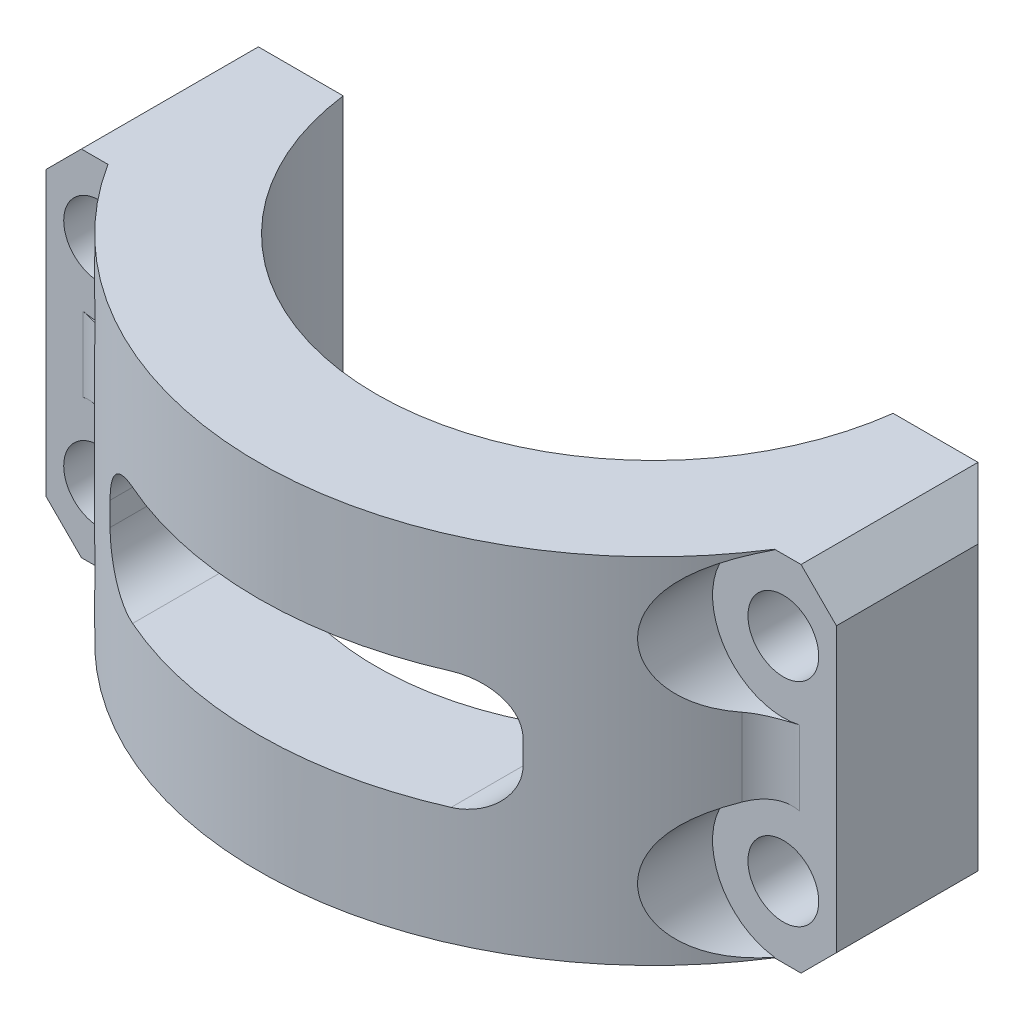
from build123d import *

# Parameters (mm, degrees)
BOSS_EXTRUDE1_DEPTH = 15
SKETCH2_R           = 3
CUT_EXTRUDE1_DEPTH  = 30
SKETCH3_W           = 35
SKETCH3_H           = 10
CUT_EXTRUDE2_DEPTH  = 50.694064129
FILLET1_R           = 4
SKETCH4_R           = 6
CUT_EXTRUDE3_DEPTH  = 30
FILLET2_R           = 4
CHAMFER1_SIZE       = 3


with BuildPart() as part:
    # Sketch1 → Boss-Extrude1 (new, symmetric)
    with BuildSketch(Plane(origin=(0, 0, 0), x_dir=(1, 0, 0), z_dir=(0, 1, 0))):
        with BuildLine():
            ThreePointArc((-28.253318389, -18), (-31.709094157, -10.806634433), (-33.365401241, -3))
            Line((-33.365401241, -3), (-33.5, -3))
            Line((-33.5, -3), (-33.5, -18))
            Line((-33.5, -18), (-28.253318389, -18))
        make_face()
        with BuildLine():
            Line((33.365401241, -3), (23.307724042, -3))
            ThreePointArc((23.307724042, -3), (0, -23.5), (-23.307724042, -3))
            Line((-23.307724042, -3), (-33.365401241, -3))
            ThreePointArc((-33.365401241, -3), (-31.709094157, -10.806634433), (-28.253318389, -18))
            ThreePointArc((-28.253318389, -18), (0, -33.5), (28.253318389, -18))
            ThreePointArc((28.253318389, -18), (31.709094157, -10.806634433), (33.365401241, -3))
        make_face()
        with BuildLine():
            Line((33.5, -3), (33.365401241, -3))
            ThreePointArc((33.365401241, -3), (31.709094157, -10.806634433), (28.253318389, -18))
            Line((28.253318389, -18), (33.5, -18))
            Line((33.5, -18), (33.5, -3))
        make_face()
    extrude(amount=BOSS_EXTRUDE1_DEPTH, both=True)

    # Sketch2 → Cut-Extrude1 (cut)
    with BuildSketch(Plane.XY):
        with Locations(Location((29, -9, 0), (0, 0, 180))):
            Circle(SKETCH2_R)
        with Locations(Location((29, 9, 0), (0, 0, 180))):
            Circle(SKETCH2_R)
        with Locations(Location((-29, 9, 0), (0, 0, 284.412066788))):
            Circle(SKETCH2_R)
        with Locations(Location((-29, -9, 0), (0, 0, 75.587933212))):
            Circle(SKETCH2_R)
    extrude(amount=CUT_EXTRUDE1_DEPTH, mode=Mode.SUBTRACT)

    # Sketch3 → Cut-Extrude2 (cut, through all)
    with BuildSketch(Plane.XY):
        Rectangle(SKETCH3_W, SKETCH3_H)
    extrude(amount=CUT_EXTRUDE2_DEPTH, mode=Mode.SUBTRACT)

    # Fillet1
    fillet1_edges = [part.edges().sort_by_distance(p)[0] for p in [
        (17.5, -5, 22.125050428),
        (17.5, 5, 22.125050428),
        (-17.5, 5, 22.125050428),
        (-17.5, -5, 22.125050428),
    ]]
    fillet(fillet1_edges, radius=FILLET1_R)

    # Sketch4 → Cut-Extrude3 (cut)
    with BuildSketch(Plane.XY.offset(18)):
        with Locations((29, 9)):
            Circle(SKETCH4_R)
        with Locations((29, -9)):
            Circle(SKETCH4_R)
        with Locations((-29, -9)):
            Circle(SKETCH4_R)
        with Locations((-29, 9)):
            Circle(SKETCH4_R)
    extrude(amount=CUT_EXTRUDE3_DEPTH, mode=Mode.SUBTRACT)

    # Fillet2
    # the kernel refuses this fillet: 4 mm, written as the material it adds along each edge
    with BuildSketch(Plane(origin=(28.253318389, 8.334769634, 18), x_dir=(1, 0, 0), z_dir=(0, -1, 0))) as fillet2_piece_1_section:
        with BuildLine():
            CenterArc((2.115250889, 4), FILLET2_R, 215.920819838, 54.079180162)
            ThreePointArc((-1.124063167, 1.653333333), (-0.549695111, 0.835053949), (0, 0))
            Line((0, 0), (2.115250889, 0))
        make_face()
    fillet2_piece_1 = extrude(amount=16.669539268, mode=Mode.PRIVATE)
    fillet2_piece_1 = fillet2_piece_1 - Plane(origin=(29, 9, 18.362807828), x_dir=(1, 0, 0), z_dir=(0, 0, -1)) * Cylinder(6, 42, mode=Mode.PRIVATE)
    fillet2_piece_1 = fillet2_piece_1 - Plane(origin=(29, -9, 18.362807828), x_dir=(1, 0, 0), z_dir=(0, 0, -1)) * Cylinder(6, 42, mode=Mode.PRIVATE)
    add(fillet2_piece_1)
    with BuildSketch(Plane(origin=(-28.253318389, -8.334769634, 18), x_dir=(-1, 0, 0), z_dir=(0, 1, 0))) as fillet2_piece_2_section:
        with BuildLine():
            CenterArc((2.115250889, 4), FILLET2_R, 215.920819838, 54.079180162)
            ThreePointArc((-1.124063167, 1.653333333), (-0.549695111, 0.835053949), (0, 0))
            Line((0, 0), (2.115250889, 0))
        make_face()
    fillet2_piece_2 = extrude(amount=16.669539268, mode=Mode.PRIVATE)
    fillet2_piece_2 = fillet2_piece_2 - Plane(origin=(-29, -9, 18.362807828), x_dir=(1, 0, 0), z_dir=(0, 0, -1)) * Cylinder(6, 42, mode=Mode.PRIVATE)
    fillet2_piece_2 = fillet2_piece_2 - Plane(origin=(-29, 9, 18.362807828), x_dir=(1, 0, 0), z_dir=(0, 0, -1)) * Cylinder(6, 42, mode=Mode.PRIVATE)
    add(fillet2_piece_2)

    # Chamfer1
    # the kernel refuses this chamfer: 3 mm, written as the material it takes off along each edge
    with BuildSketch(Plane(origin=(33.5, -15, 25.715048964), x_dir=(-0.9996219169112968, -0.02749587661058619, 0), z_dir=(0, 0, -1)), Plane(origin=(-33.5, 15, -4.715048964), x_dir=(-0.02749587661058678, -0.9996219169112968, 0), z_dir=(0, 0, 1))) as chamfer1_piece_1:
        Polygon((CHAMFER1_SIZE * 0.999621916911, CHAMFER1_SIZE * 0.0274958766106), (-CHAMFER1_SIZE * 0.0274958766106, CHAMFER1_SIZE * 0.999621916911), (0, 0), align=None)
    extrude(amount=30.430097928, mode=Mode.SUBTRACT)
    with BuildSketch(Plane(origin=(-33.5, 22.715048964, 3), x_dir=(-0.02749587661058677, 0, 0.9996219169112968), z_dir=(0, -1, 0)), Plane(origin=(33.5, -22.715048964, 3), x_dir=(0.027495876610586757, 0, 0.9996219169112968), z_dir=(0, 1, 0))) as chamfer1_piece_2:
        Polygon((CHAMFER1_SIZE * 0.999621916911, -CHAMFER1_SIZE * 0.0274958766106), (-CHAMFER1_SIZE * 0.0274958766106, -CHAMFER1_SIZE * 0.999621916911), (0, 0), align=None)
    extrude(amount=45.430097928, mode=Mode.SUBTRACT)
    with BuildSketch(Plane(origin=(33.5, 15, 25.715048964), x_dir=(-0.9996219169112968, 0.02749587661058619, 0), z_dir=(0, 0, -1)), Plane(origin=(-33.5, -15, -4.715048964), x_dir=(-0.02749587661058678, 0.9996219169112968, 0), z_dir=(0, 0, 1))) as chamfer1_piece_3:
        Polygon((CHAMFER1_SIZE * 0.999621916911, -CHAMFER1_SIZE * 0.0274958766106), (-CHAMFER1_SIZE * 0.0274958766106, -CHAMFER1_SIZE * 0.999621916911), (0, 0), align=None)
    extrude(amount=30.430097928, mode=Mode.SUBTRACT)


solid = part.part
